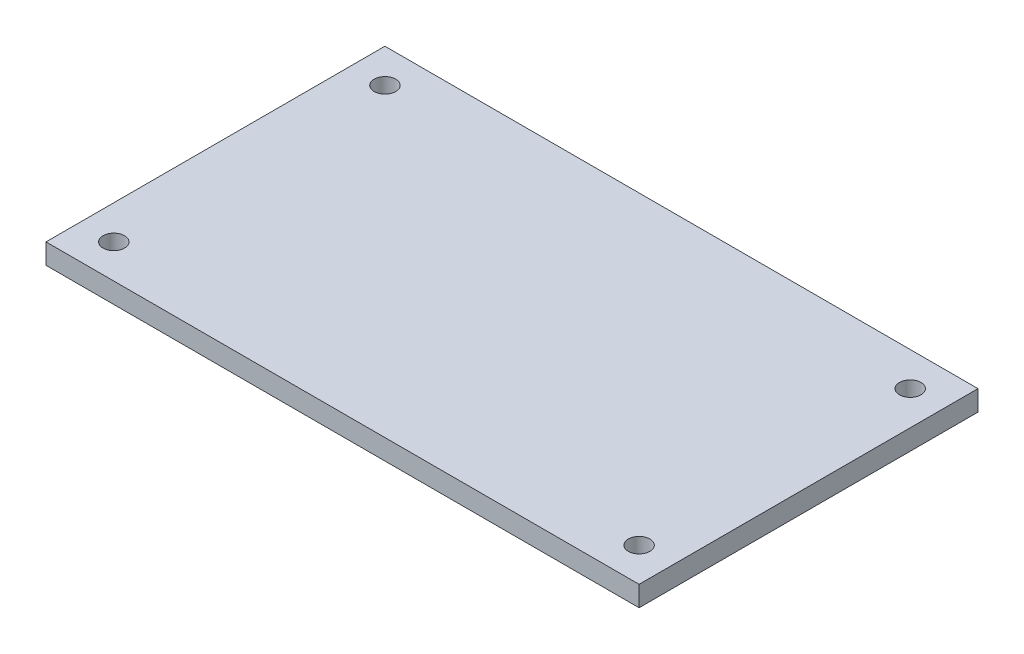
from build123d import *

# Parameters (mm, degrees)
SKETCH1_W           = 175
SKETCH1_H           = 100
SKETCH1_R           = 3.175
BOSS_EXTRUDE1_DEPTH = 6


with BuildPart() as part:
    # Sketch1 → Boss-Extrude1 (new body)
    with BuildSketch(Plane(origin=(0, 0, 0), x_dir=(1, 0, 0), z_dir=(0, 1, 0))):
        Rectangle(SKETCH1_W, SKETCH1_H)
        with Locations((-77.5, -40)):
            Circle(SKETCH1_R, mode=Mode.SUBTRACT)
        with Locations((-77.5, 40)):
            Circle(SKETCH1_R, mode=Mode.SUBTRACT)
        with Locations((77.5, 40)):
            Circle(SKETCH1_R, mode=Mode.SUBTRACT)
        with Locations((77.5, -40)):
            Circle(SKETCH1_R, mode=Mode.SUBTRACT)
    extrude(amount=BOSS_EXTRUDE1_DEPTH)


solid = part.part
